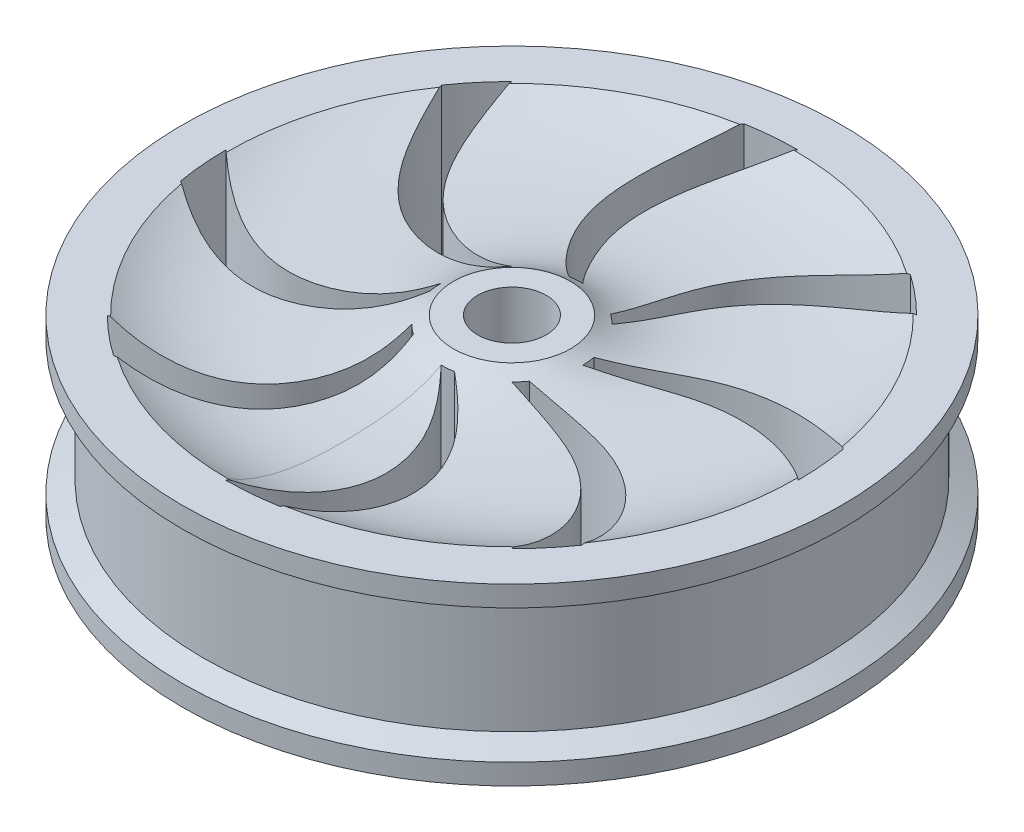
from build123d import *
from build123d.topology import SkipClean

# Parameters (mm, degrees)
CUT_EXTRUDE1_DEPTH = 20
CIRPATTERN1_COUNT  = 8


with BuildPart() as part:
    # Sketch2 → Revolve1 (revolve)
    with BuildSketch(Plane.XY):
        Polygon((5, 0), (48, 0), (48, 3), (45, 4.732050808), (45, 12.732050808), (5, 12.732050808), align=None)
    revolve(axis=Axis((0, 23.944929145, 0), (0, -1, 0)))

    # Sketch4 → Cut-Extrude1 (cut)
    with BuildSketch(Plane.XZ):
        with BuildLine():
            ThreePointArc((-10.312132995, 0), (-10.272892216, 0.898761611), (-10.155468524, 1.790683102))
            add(Edge.make_bspline(
                [(-41.032900997, 7.235207543), (-22.692747181, 18.414696568), (-10.155468524, 1.790683102)],
                knots=[0, 0, 0, 1, 1, 1], degree=2))
            ThreePointArc((-41.032900997, 7.235207543), (-41.507348308, 3.63142243), (-41.665899635, 0))
            add(Edge.make_bspline(
                [(-41.665899635, 0), (-25.545671862, 14.194381755), (-10.312132995, 0)],
                knots=[0, 0, 0, 1, 1, 1], degree=2))
        make_face()
    cut_extrude1 = extrude(amount=-CUT_EXTRUDE1_DEPTH, mode=Mode.SUBTRACT)

    # CirPattern1: Cut-Extrude1 ×8 about axis
    cirpattern1_axis = Axis((0, 0, 0), (0, 1, 0))
    for i in range(1, CIRPATTERN1_COUNT):
        add(cut_extrude1.rotate(cirpattern1_axis, i * 360 / CIRPATTERN1_COUNT), mode=Mode.SUBTRACT)

    # Sketch5 → Cut-Revolve1 (revolve, cut)
    with SkipClean():  # the faces are left unmerged after this step: merging them gives an invalid solid
        with BuildSketch(Plane.XY):
            with BuildLine():
                Line((8.519948304, 0), (41.333485132, 0))
                add(Edge.make_bspline(
                    [(8.519948304, 0), (12.473326312, 2.95192334), (23.960939246, 4.201569048), (35.417771219, 3.490762834), (41.333485132, 0)],
                    knots=[0, 0, 0, 0, 0.416820579, 1, 1, 1, 1], degree=3))
            make_face()
        revolve(axis=Axis((0, 22.182829611, 0), (0, -1, 0)), mode=Mode.SUBTRACT)
    add(part.part.scale(1), mode=Mode.REPLACE)  # the faces are merged on a copy

    # Mirror1: part across plane


with BuildPart() as part_1:
    add(part.part)
    add(part.part.mirror(Plane(origin=(5, 12.732050808, 0), x_dir=(0, 0, 1), z_dir=(0, -1, 0))))


solid = part_1.part
